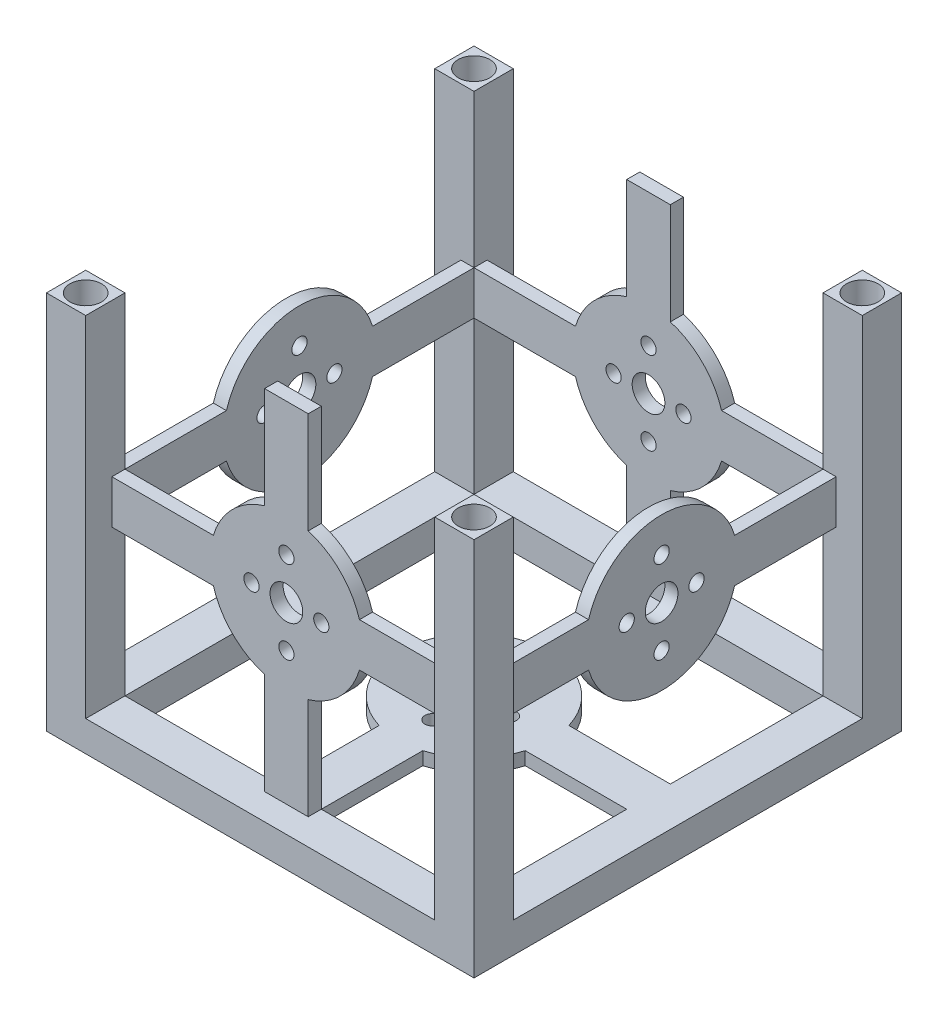
from build123d import *

# Parameters (mm, degrees)
SKETCH2_R                  = 1.75
SKETCH2_W                  = 10
SKETCH2_H                  = 10
BOSS_EXTRUDE1_DEPTH        = 3
CIRPATTERN1_COUNT          = 4
CIRPATTERN2_START          = 40
CIRPATTERN2_OUTLINE_R      = 1.75
CIRPATTERN2_DEPTH          = 3
CIRPATTERN2_START_2        = -43
CIRPATTERN2_2_OUTLINE_R    = 1.75
CIRPATTERN2_2_DEPTH        = 3
CIRPATTERN2_3_OUTLINE_R    = 1.75
CIRPATTERN2_3_DEPTH        = 3
CIRPATTERN2_4_OUTLINE_R    = 1.75
CIRPATTERN2_4_DEPTH        = 3
BOSS_EXTRUDE2_DEPTH        = 50
BOSS_EXTRUDE2_DEPTH_BACK   = 50
SKETCH3_W                  = 10
SKETCH3_H                  = 10
BOSS_EXTRUDE2_2_DEPTH      = 50
BOSS_EXTRUDE2_2_DEPTH_BACK = 50
BOSS_EXTRUDE2_3_DEPTH      = 50
BOSS_EXTRUDE2_3_DEPTH_BACK = 50
BOSS_EXTRUDE2_4_DEPTH      = 50
BOSS_EXTRUDE2_4_DEPTH_BACK = 50
SKETCH4_W                  = 100
SKETCH4_H                  = 100
SKETCH4_W_2                = 80
SKETCH4_H_2                = 80
BOSS_EXTRUDE3_DEPTH        = 10
SKETCH5_W                  = 100
SKETCH5_H                  = 100
SKETCH5_W_2                = 80
SKETCH5_H_2                = 80
BOSS_EXTRUDE4_DEPTH        = 10
SKETCH7_R                  = 3.75
CUT_EXTRUDE2_DEPTH         = 10
SKETCH8_R                  = 3.75
CUT_EXTRUDE3_DEPTH         = 117.828934772
SKETCH9_R                  = 3.75
CUT_EXTRUDE4_DEPTH         = 117.828934772
SKETCH10_W                 = 100
SKETCH10_H                 = 100
CUT_EXTRUDE5_DEPTH         = 3
SKETCH11_W                 = 100
SKETCH11_H                 = 97
CUT_EXTRUDE6_DEPTH         = 1
SKETCH12_W                 = 99
SKETCH12_H                 = 97
CUT_EXTRUDE7_DEPTH         = 1
SKETCH13_W                 = 99
SKETCH13_H                 = 97
CUT_EXTRUDE8_DEPTH         = 1
SKETCH14_W                 = 98
SKETCH14_H                 = 97
CUT_EXTRUDE9_DEPTH         = 1
SKETCH16_W                 = 98
SKETCH16_H                 = 98
CUT_EXTRUDE10_DEPTH        = 10
SKETCH17_R                 = 3.625
CUT_EXTRUDE11_DEPTH        = 10
CUT_EXTRUDE14_DEPTH        = 115.341593482


# Read off the part's stored shape, not the designer's step: CirPattern2
with BuildPart() as part:
    # Sketch2 → Boss-Extrude1 (new body)
    # profile 1 of 13: a face of its own
    with BuildSketch(Plane.XY.offset(40)):
        with BuildLine():
            ThreePointArc((5, -16.74259435), (0, -17.47325), (-5, -16.74259435))
            Line((-5, -16.74259435), (-5, -50))
            Line((-5, -50), (5, -50))
            Line((5, -50), (5, -16.74259435))
        make_face()
    # profile 2 of 13: a face of its own
    with BuildSketch(Plane.XY.offset(40)):
        with BuildLine():
            Line((5, -5), (-5, -5))
            Line((-5, -5), (-5, -16.74259435))
            ThreePointArc((-5, -16.74259435), (0, -17.47325), (5, -16.74259435))
            Line((5, -16.74259435), (5, -5))
        make_face()
        with Locations((0, -9.5)):
            Circle(SKETCH2_R, mode=Mode.SUBTRACT)
    # profile 3 of 13: a face of its own
    with BuildSketch(Plane.XY.offset(40)):
        with BuildLine():
            Line((16.74259435, -5), (5, -5))
            Line((5, -5), (5, -16.74259435))
            ThreePointArc((5, -16.74259435), (12.355453564, -12.355453564), (16.74259435, -5))
        make_face()
    # profile 4 of 13: a face of its own
    with BuildSketch(Plane.XY.offset(40)):
        with BuildLine():
            Line((5, 5), (5, -5))
            Line((5, -5), (16.74259435, -5))
            ThreePointArc((16.74259435, -5), (17.289621197, -2.526551883), (17.47325, 0))
            ThreePointArc((17.47325, 0), (17.289621197, 2.526551883), (16.74259435, 5))
            Line((16.74259435, 5), (5, 5))
        make_face()
        with Locations((8, 0)):
            Circle(SKETCH2_R, mode=Mode.SUBTRACT)
    # profile 5 of 13: a face of its own
    with BuildSketch(Plane.XY.offset(40)):
        Rectangle(SKETCH2_W, SKETCH2_H)
    # profile 6 of 13: a face of its own
    with BuildSketch(Plane.XY.offset(40)):
        with BuildLine():
            Line((-5, -5), (-16.74259435, -5))
            ThreePointArc((-16.74259435, -5), (-12.355453564, -12.355453564), (-5, -16.74259435))
            Line((-5, -16.74259435), (-5, -5))
        make_face()
    # profile 7 of 13: a face of its own
    with BuildSketch(Plane.XY.offset(40)):
        with BuildLine():
            ThreePointArc((-16.74259435, 5), (-17.47325, 0), (-16.74259435, -5))
            Line((-16.74259435, -5), (-5, -5))
            Line((-5, -5), (-5, 5))
            Line((-5, 5), (-16.74259435, 5))
        make_face()
        with Locations((-8, 0)):
            Circle(SKETCH2_R, mode=Mode.SUBTRACT)
    # profile 8 of 13: a face of its own
    with BuildSketch(Plane.XY.offset(40)):
        with BuildLine():
            ThreePointArc((-5, 16.74259435), (-12.355453564, 12.355453564), (-16.74259435, 5))
            Line((-16.74259435, 5), (-5, 5))
            Line((-5, 5), (-5, 16.74259435))
        make_face()
    # profile 9 of 13: a face of its own
    with BuildSketch(Plane.XY.offset(40)):
        with BuildLine():
            Line((-5, 16.74259435), (-5, 5))
            Line((-5, 5), (5, 5))
            Line((5, 5), (5, 16.74259435))
            ThreePointArc((5, 16.74259435), (0, 17.47325), (-5, 16.74259435))
        make_face()
        with Locations((0, 9.5)):
            Circle(SKETCH2_R, mode=Mode.SUBTRACT)
    # profile 10 of 13: a face of its own
    with BuildSketch(Plane.XY.offset(40)):
        with BuildLine():
            Line((5, 16.74259435), (5, 5))
            Line((5, 5), (16.74259435, 5))
            ThreePointArc((16.74259435, 5), (12.355453564, 12.355453564), (5, 16.74259435))
        make_face()
    # profile 11 of 13: a face of its own
    with BuildSketch(Plane.XY.offset(40)):
        with BuildLine():
            ThreePointArc((17.47325, 0), (17.289621197, -2.526551883), (16.74259435, -5))
            Line((16.74259435, -5), (50, -5))
            Line((50, -5), (50, 5))
            Line((50, 5), (16.74259435, 5))
            ThreePointArc((16.74259435, 5), (17.289621197, 2.526551883), (17.47325, 0))
        make_face()
    # profile 12 of 13: a face of its own
    with BuildSketch(Plane.XY.offset(40)):
        with BuildLine():
            Line((-50, 5), (-50, -5))
            Line((-50, -5), (-16.74259435, -5))
            ThreePointArc((-16.74259435, -5), (-17.47325, 0), (-16.74259435, 5))
            Line((-16.74259435, 5), (-50, 5))
        make_face()
    # profile 13 of 13: a face of its own
    with BuildSketch(Plane.XY.offset(40)):
        with BuildLine():
            Line((-5, 50), (-5, 16.74259435))
            ThreePointArc((-5, 16.74259435), (0, 17.47325), (5, 16.74259435))
            Line((5, 16.74259435), (5, 50))
            Line((5, 50), (-5, 50))
        make_face()
    extrude(amount=BOSS_EXTRUDE1_DEPTH)


with BuildPart() as cirpattern1_1:
    # CirPattern1: pattern copy
    add(part.part.rotate(Axis((0, 0, 0), (1, 0, 0)), 1 * 360 / CIRPATTERN1_COUNT))


with BuildPart() as cirpattern1_2:
    # CirPattern1: pattern copy
    add(part.part.rotate(Axis((0, 0, 0), (1, 0, 0)), 2 * 360 / CIRPATTERN1_COUNT))


with BuildPart() as cirpattern1_3:
    # CirPattern1: pattern copy
    add(part.part.rotate(Axis((0, 0, 0), (1, 0, 0)), 3 * 360 / CIRPATTERN1_COUNT))


with BuildPart() as body_5:
    # CirPattern2 outline → CirPattern2 (new body)
    with BuildSketch(Plane.XY.offset(CIRPATTERN2_START)):
        with BuildLine():
            ThreePointArc((5, -16.74259435), (12.355453564, -12.355453564), (16.74259435, -5))
            Line((16.74259435, -5), (50, -5))
            Line((50, -5), (50, 5))
            Line((50, 5), (16.74259435, 5))
            ThreePointArc((16.74259435, 5), (12.355453564, 12.355453564), (5, 16.74259435))
            Line((5, 16.74259435), (5, 50))
            Line((5, 50), (-5, 50))
            Line((-5, 50), (-5, 16.74259435))
            ThreePointArc((-5, 16.74259435), (-12.355453564, 12.355453564), (-16.74259435, 5))
            Line((-16.74259435, 5), (-50, 5))
            Line((-50, 5), (-50, -5))
            Line((-50, -5), (-16.74259435, -5))
            ThreePointArc((-16.74259435, -5), (-12.355453564, -12.355453564), (-5, -16.74259435))
            Line((-5, -16.74259435), (-5, -50))
            Line((-5, -50), (5, -50))
            Line((5, -50), (5, -16.74259435))
        make_face()
        with Locations((0, -9.5)):
            Circle(CIRPATTERN2_OUTLINE_R, mode=Mode.SUBTRACT)
        with Locations((-8, 0)):
            Circle(CIRPATTERN2_OUTLINE_R, mode=Mode.SUBTRACT)
        with Locations((8, 0)):
            Circle(CIRPATTERN2_OUTLINE_R, mode=Mode.SUBTRACT)
        with Locations((0, 9.5)):
            Circle(CIRPATTERN2_OUTLINE_R, mode=Mode.SUBTRACT)
    extrude(amount=CIRPATTERN2_DEPTH)


with BuildPart() as body_6:
    # CirPattern2 2 outline → CirPattern2 2 (new body)
    with BuildSketch(Plane.YZ.offset(CIRPATTERN2_START_2)):
        with BuildLine():
            Line((-5, 50), (-5, 16.74259435))
            ThreePointArc((-5, 16.74259435), (-12.355453564, 12.355453564), (-16.74259435, 5))
            Line((-16.74259435, 5), (-50, 5))
            Line((-50, 5), (-50, -5))
            Line((-50, -5), (-16.74259435, -5))
            ThreePointArc((-16.74259435, -5), (-12.355453564, -12.355453564), (-5, -16.74259435))
            Line((-5, -16.74259435), (-5, -50))
            Line((-5, -50), (5, -50))
            Line((5, -50), (5, -16.74259435))
            ThreePointArc((5, -16.74259435), (12.355453564, -12.355453564), (16.74259435, -5))
            Line((16.74259435, -5), (50, -5))
            Line((50, -5), (50, 5))
            Line((50, 5), (16.74259435, 5))
            ThreePointArc((16.74259435, 5), (12.355453564, 12.355453564), (5, 16.74259435))
            Line((5, 16.74259435), (5, 50))
            Line((5, 50), (-5, 50))
        make_face()
        with Locations((0, -8)):
            Circle(CIRPATTERN2_2_OUTLINE_R, mode=Mode.SUBTRACT)
        with Locations((-9.5, 0)):
            Circle(CIRPATTERN2_2_OUTLINE_R, mode=Mode.SUBTRACT)
        with Locations((9.5, 0)):
            Circle(CIRPATTERN2_2_OUTLINE_R, mode=Mode.SUBTRACT)
        with Locations((0, 8)):
            Circle(CIRPATTERN2_2_OUTLINE_R, mode=Mode.SUBTRACT)
    extrude(amount=CIRPATTERN2_2_DEPTH)


with BuildPart() as body_7:
    # CirPattern2 3 outline → CirPattern2 3 (new body)
    with BuildSketch(Plane.YZ.offset(CIRPATTERN2_START)):
        with BuildLine():
            ThreePointArc((-16.74259435, -5), (-12.355453564, -12.355453564), (-5, -16.74259435))
            Line((-5, -16.74259435), (-5, -50))
            Line((-5, -50), (5, -50))
            Line((5, -50), (5, -16.74259435))
            ThreePointArc((5, -16.74259435), (12.355453564, -12.355453564), (16.74259435, -5))
            Line((16.74259435, -5), (50, -5))
            Line((50, -5), (50, 5))
            Line((50, 5), (16.74259435, 5))
            ThreePointArc((16.74259435, 5), (12.355453564, 12.355453564), (5, 16.74259435))
            Line((5, 16.74259435), (5, 50))
            Line((5, 50), (-5, 50))
            Line((-5, 50), (-5, 16.74259435))
            ThreePointArc((-5, 16.74259435), (-12.355453564, 12.355453564), (-16.74259435, 5))
            Line((-16.74259435, 5), (-50, 5))
            Line((-50, 5), (-50, -5))
            Line((-50, -5), (-16.74259435, -5))
        make_face()
        with Locations((0, -8)):
            Circle(CIRPATTERN2_3_OUTLINE_R, mode=Mode.SUBTRACT)
        with Locations((-9.5, 0)):
            Circle(CIRPATTERN2_3_OUTLINE_R, mode=Mode.SUBTRACT)
        with Locations((9.5, 0)):
            Circle(CIRPATTERN2_3_OUTLINE_R, mode=Mode.SUBTRACT)
        with Locations((0, 8)):
            Circle(CIRPATTERN2_3_OUTLINE_R, mode=Mode.SUBTRACT)
    extrude(amount=CIRPATTERN2_3_DEPTH)


with BuildPart() as body_8:
    # CirPattern2 4 outline → CirPattern2 4 (new body)
    with BuildSketch(Plane.XY.offset(CIRPATTERN2_START_2)):
        with BuildLine():
            Line((50, 5), (16.74259435, 5))
            ThreePointArc((16.74259435, 5), (12.355453564, 12.355453564), (5, 16.74259435))
            Line((5, 16.74259435), (5, 50))
            Line((5, 50), (-5, 50))
            Line((-5, 50), (-5, 16.74259435))
            ThreePointArc((-5, 16.74259435), (-12.355453564, 12.355453564), (-16.74259435, 5))
            Line((-16.74259435, 5), (-50, 5))
            Line((-50, 5), (-50, -5))
            Line((-50, -5), (-16.74259435, -5))
            ThreePointArc((-16.74259435, -5), (-12.355453564, -12.355453564), (-5, -16.74259435))
            Line((-5, -16.74259435), (-5, -50))
            Line((-5, -50), (5, -50))
            Line((5, -50), (5, -16.74259435))
            ThreePointArc((5, -16.74259435), (12.355453564, -12.355453564), (16.74259435, -5))
            Line((16.74259435, -5), (50, -5))
            Line((50, -5), (50, 5))
        make_face()
        with Locations((0, -9.5)):
            Circle(CIRPATTERN2_4_OUTLINE_R, mode=Mode.SUBTRACT)
        with Locations((-8, 0)):
            Circle(CIRPATTERN2_4_OUTLINE_R, mode=Mode.SUBTRACT)
        with Locations((8, 0)):
            Circle(CIRPATTERN2_4_OUTLINE_R, mode=Mode.SUBTRACT)
        with Locations((0, 9.5)):
            Circle(CIRPATTERN2_4_OUTLINE_R, mode=Mode.SUBTRACT)
    extrude(amount=CIRPATTERN2_4_DEPTH)


with BuildPart() as body_9:
    # Sketch3 → Boss-Extrude2 (new, two sides: drawn at the far end of the back side and taken through both)
    with BuildSketch(Plane(origin=(0, 0, 0), x_dir=(1, 0, 0), z_dir=(0, 1, 0)).offset(-BOSS_EXTRUDE2_DEPTH_BACK)):
        with Locations((-45, -45)):
            Rectangle(SKETCH3_W, SKETCH3_H)
    extrude(amount=BOSS_EXTRUDE2_DEPTH + BOSS_EXTRUDE2_DEPTH_BACK)


with BuildPart() as body_10:
    # Sketch3 → Boss-Extrude2 2 (new, two sides: drawn at the far end of the back side and taken through both)
    with BuildSketch(Plane(origin=(0, 0, 0), x_dir=(1, 0, 0), z_dir=(0, 1, 0)).offset(-BOSS_EXTRUDE2_2_DEPTH_BACK)):
        with Locations((45, -45)):
            Rectangle(SKETCH3_W, SKETCH3_H)
    extrude(amount=BOSS_EXTRUDE2_2_DEPTH + BOSS_EXTRUDE2_2_DEPTH_BACK)


with BuildPart() as body_11:
    # Sketch3 → Boss-Extrude2 3 (new, two sides: drawn at the far end of the back side and taken through both)
    with BuildSketch(Plane(origin=(0, 0, 0), x_dir=(1, 0, 0), z_dir=(0, 1, 0)).offset(-BOSS_EXTRUDE2_3_DEPTH_BACK)):
        with Locations((45, 45)):
            Rectangle(SKETCH3_W, SKETCH3_H)
    extrude(amount=BOSS_EXTRUDE2_3_DEPTH + BOSS_EXTRUDE2_3_DEPTH_BACK)


with BuildPart() as body_12:
    # Sketch3 → Boss-Extrude2 4 (new, two sides: drawn at the far end of the back side and taken through both)
    with BuildSketch(Plane(origin=(0, 0, 0), x_dir=(1, 0, 0), z_dir=(0, 1, 0)).offset(-BOSS_EXTRUDE2_4_DEPTH_BACK)):
        with Locations((-45, 45)):
            Rectangle(SKETCH3_W, SKETCH3_H)
    extrude(amount=BOSS_EXTRUDE2_4_DEPTH + BOSS_EXTRUDE2_4_DEPTH_BACK)


with BuildPart() as part_1:
    add(part.part)

    add(cirpattern1_1.part)  # Boss-Extrude3 merges CirPattern1_1

    add(cirpattern1_2.part)  # Boss-Extrude3 merges CirPattern1_2

    add(body_5.part)  # Boss-Extrude3 merges body 5

    add(body_6.part)  # Boss-Extrude3 merges body 6

    add(body_7.part)  # Boss-Extrude3 merges body 7

    add(body_8.part)  # Boss-Extrude3 merges body 8

    add(body_9.part)  # Boss-Extrude3 merges body 9

    add(body_10.part)  # Boss-Extrude3 merges body 10

    add(body_11.part)  # Boss-Extrude3 merges body 11

    add(body_12.part)  # Boss-Extrude3 merges body 12
    # Sketch4 → Boss-Extrude3 (add)
    with BuildSketch(Plane.XZ.offset(50)):
        Rectangle(SKETCH4_W, SKETCH4_H)
        Rectangle(SKETCH4_W_2, SKETCH4_H_2, mode=Mode.SUBTRACT)
    extrude(amount=-BOSS_EXTRUDE3_DEPTH)

    add(cirpattern1_3.part)  # Boss-Extrude4 merges CirPattern1_3
    # Sketch5 → Boss-Extrude4 (add)
    with BuildSketch(Plane(origin=(0, 50, 0), x_dir=(1, 0, 0), z_dir=(0, 1, 0))):
        Rectangle(SKETCH5_W, SKETCH5_H)
        Rectangle(SKETCH5_W_2, SKETCH5_H_2, mode=Mode.SUBTRACT)
    extrude(amount=-BOSS_EXTRUDE4_DEPTH)

    # Sketch7 → Cut-Extrude2 (cut)
    with BuildSketch(Plane.XZ.offset(43)):
        with Locations(Location((0, 0, 0), (0, 0, 270))):
            Circle(SKETCH7_R)
    extrude(amount=-CUT_EXTRUDE2_DEPTH, mode=Mode.SUBTRACT)

    # Sketch8 → Cut-Extrude3 (cut, through all)
    with BuildSketch(Plane.ZY.offset(43)):
        Circle(SKETCH8_R)
    extrude(amount=-CUT_EXTRUDE3_DEPTH, mode=Mode.SUBTRACT)

    # Sketch9 → Cut-Extrude4 (cut, through all)
    with BuildSketch(Plane(origin=(0, 0, -43), x_dir=(-1, 0, 0), z_dir=(0, 0, -1))):
        Circle(SKETCH9_R)
    extrude(amount=-CUT_EXTRUDE4_DEPTH, mode=Mode.SUBTRACT)

    # Sketch10 → Cut-Extrude5 (cut)
    with BuildSketch(Plane.XZ.offset(50)):
        Rectangle(SKETCH10_W, SKETCH10_H)
    extrude(amount=-CUT_EXTRUDE5_DEPTH, mode=Mode.SUBTRACT)

    # Sketch11 → Cut-Extrude6 (cut)
    with BuildSketch(Plane.ZY.offset(50)):
        with Locations((0, 1.5)):
            Rectangle(SKETCH11_W, SKETCH11_H)
    extrude(amount=-CUT_EXTRUDE6_DEPTH, mode=Mode.SUBTRACT)

    # Sketch12 → Cut-Extrude7 (cut)
    with BuildSketch(Plane.XY.offset(50)):
        with Locations((0.5, 1.5)):
            Rectangle(SKETCH12_W, SKETCH12_H)
    extrude(amount=-CUT_EXTRUDE7_DEPTH, mode=Mode.SUBTRACT)

    # Sketch13 → Cut-Extrude8 (cut)
    with BuildSketch(Plane(origin=(50, 0, 0), x_dir=(0, 0, -1), z_dir=(1, 0, 0))):
        with Locations((0.5, 1.5)):
            Rectangle(SKETCH13_W, SKETCH13_H)
    extrude(amount=-CUT_EXTRUDE8_DEPTH, mode=Mode.SUBTRACT)

    # Sketch14 → Cut-Extrude9 (cut)
    with BuildSketch(Plane(origin=(0, 0, -50), x_dir=(-1, 0, 0), z_dir=(0, 0, -1))):
        with Locations((0, 1.5)):
            Rectangle(SKETCH14_W, SKETCH14_H)
    extrude(amount=-CUT_EXTRUDE9_DEPTH, mode=Mode.SUBTRACT)

    # Sketch16 → Cut-Extrude10 (cut)
    with BuildSketch(Plane.XZ.offset(-40)):
        Rectangle(SKETCH16_W, SKETCH16_H)
    extrude(amount=-CUT_EXTRUDE10_DEPTH, mode=Mode.SUBTRACT)

    # Sketch17 → Cut-Extrude11 (cut)
    with BuildSketch(Plane(origin=(0, 40, 0), x_dir=(1, 0, 0), z_dir=(0, 1, 0))):
        with Locations(Location((44.5, 44.5, 0), (0, 0, 270))):
            Circle(SKETCH17_R)
        with Locations(Location((44.5, -44.5, 0), (0, 0, 270))):
            Circle(SKETCH17_R)
        with Locations(Location((-44.5, -44.5, 0), (0, 0, 270))):
            Circle(SKETCH17_R)
        with Locations(Location((-44.5, 44.5, 0), (0, 0, 270))):
            Circle(SKETCH17_R)
    extrude(amount=-CUT_EXTRUDE11_DEPTH, mode=Mode.SUBTRACT)

    # Sketch18 → Cut-Extrude14 (cut, through all)
    with BuildSketch(Plane(origin=(43, 0, 0), x_dir=(0, 0, -1), z_dir=(1, 0, 0))):
        with BuildLine():
            Line((-5, 40), (-5, 16.74259435))
            ThreePointArc((-5, 16.74259435), (0, 17.47325), (5, 16.74259435))
            Line((5, 16.74259435), (5, 40))
            Line((5, 40), (-5, 40))
        make_face()
        with BuildLine():
            Line((5, -40), (5, -16.74259435))
            ThreePointArc((5, -16.74259435), (0, -17.47325), (-5, -16.74259435))
            Line((-5, -16.74259435), (-5, -40))
            Line((-5, -40), (5, -40))
        make_face()
    extrude(amount=-CUT_EXTRUDE14_DEPTH, mode=Mode.SUBTRACT)


solid = part_1.part
